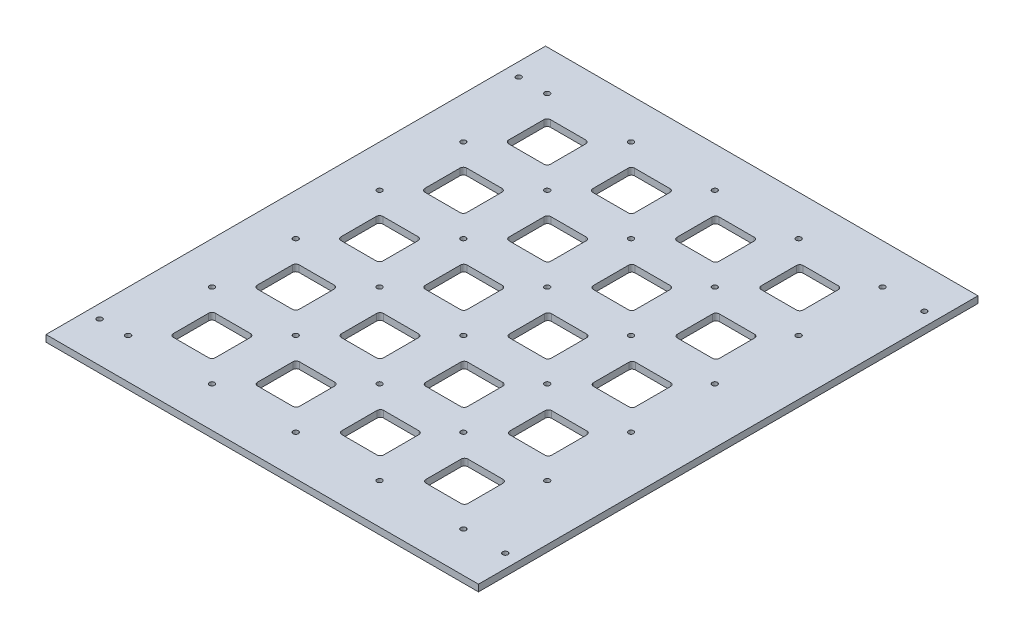
from build123d import *

# Parameters (mm, degrees)
SKETCH1_W           = 258
SKETCH1_H           = 298
SKETCH1_R           = 1.55
BOSS_EXTRUDE1_DEPTH = 4


with BuildPart() as part:
    # Sketch1 → Boss-Extrude1 (new body)
    with BuildSketch(Plane(origin=(0, 0, 0), x_dir=(1, 0, 0), z_dir=(0, 1, 0))):
        with Locations((-129, 149)):
            Rectangle(SKETCH1_W, SKETCH1_H)
        with Locations((-250, 274)):
            Circle(SKETCH1_R, mode=Mode.SUBTRACT)
        with Locations((-8, 274)):
            Circle(SKETCH1_R, mode=Mode.SUBTRACT)
        with Locations((-8, 24)):
            Circle(SKETCH1_R, mode=Mode.SUBTRACT)
        with Locations((-250, 24)):
            Circle(SKETCH1_R, mode=Mode.SUBTRACT)
        with Locations((-233, 274)):
            Circle(SKETCH1_R, mode=Mode.SUBTRACT)
        with Locations((-233, 224)):
            Circle(SKETCH1_R, mode=Mode.SUBTRACT)
        with Locations((-233, 174)):
            Circle(SKETCH1_R, mode=Mode.SUBTRACT)
        with Locations((-233, 124)):
            Circle(SKETCH1_R, mode=Mode.SUBTRACT)
        with Locations((-233, 74)):
            Circle(SKETCH1_R, mode=Mode.SUBTRACT)
        with Locations((-233, 24)):
            Circle(SKETCH1_R, mode=Mode.SUBTRACT)
        with Locations((-183, 24)):
            Circle(SKETCH1_R, mode=Mode.SUBTRACT)
        with Locations((-183, 74)):
            Circle(SKETCH1_R, mode=Mode.SUBTRACT)
        with Locations((-183, 124)):
            Circle(SKETCH1_R, mode=Mode.SUBTRACT)
        with Locations((-183, 174)):
            Circle(SKETCH1_R, mode=Mode.SUBTRACT)
        with Locations((-183, 224)):
            Circle(SKETCH1_R, mode=Mode.SUBTRACT)
        with Locations((-183, 274)):
            Circle(SKETCH1_R, mode=Mode.SUBTRACT)
        with Locations((-133, 24)):
            Circle(SKETCH1_R, mode=Mode.SUBTRACT)
        with Locations((-133, 74)):
            Circle(SKETCH1_R, mode=Mode.SUBTRACT)
        with Locations((-133, 124)):
            Circle(SKETCH1_R, mode=Mode.SUBTRACT)
        with Locations((-133, 174)):
            Circle(SKETCH1_R, mode=Mode.SUBTRACT)
        with Locations((-133, 224)):
            Circle(SKETCH1_R, mode=Mode.SUBTRACT)
        with Locations((-133, 274)):
            Circle(SKETCH1_R, mode=Mode.SUBTRACT)
        with Locations((-83, 24)):
            Circle(SKETCH1_R, mode=Mode.SUBTRACT)
        with Locations((-83, 74)):
            Circle(SKETCH1_R, mode=Mode.SUBTRACT)
        with Locations((-83, 124)):
            Circle(SKETCH1_R, mode=Mode.SUBTRACT)
        with Locations((-83, 174)):
            Circle(SKETCH1_R, mode=Mode.SUBTRACT)
        with Locations((-83, 224)):
            Circle(SKETCH1_R, mode=Mode.SUBTRACT)
        with Locations((-83, 274)):
            Circle(SKETCH1_R, mode=Mode.SUBTRACT)
        with Locations((-33, 24)):
            Circle(SKETCH1_R, mode=Mode.SUBTRACT)
        with Locations((-33, 74)):
            Circle(SKETCH1_R, mode=Mode.SUBTRACT)
        with Locations((-33, 124)):
            Circle(SKETCH1_R, mode=Mode.SUBTRACT)
        with Locations((-33, 174)):
            Circle(SKETCH1_R, mode=Mode.SUBTRACT)
        with Locations((-33, 224)):
            Circle(SKETCH1_R, mode=Mode.SUBTRACT)
        with Locations((-33, 274)):
            Circle(SKETCH1_R, mode=Mode.SUBTRACT)
        with BuildLine():
            Line((-218.5, 261.5), (-197.5, 261.5))
            ThreePointArc((-197.5, 261.5), (-196.085786438, 260.914213562), (-195.5, 259.5))
            Line((-195.5, 259.5), (-195.5, 238.5))
            ThreePointArc((-195.5, 238.5), (-196.085786438, 237.085786438), (-197.5, 236.5))
            Line((-197.5, 236.5), (-218.5, 236.5))
            ThreePointArc((-218.5, 236.5), (-219.914213562, 237.085786438), (-220.5, 238.5))
            Line((-220.5, 238.5), (-220.5, 259.5))
            ThreePointArc((-220.5, 259.5), (-219.914213562, 260.914213562), (-218.5, 261.5))
        make_face(mode=Mode.SUBTRACT)
        with BuildLine():
            Line((-170.273804043, 259.5), (-170.273804043, 238.5))
            ThreePointArc((-170.273804043, 238.5), (-169.688017605, 237.085786438), (-168.273804043, 236.5))
            Line((-168.273804043, 236.5), (-147.273804043, 236.5))
            ThreePointArc((-147.273804043, 236.5), (-145.85959048, 237.085786438), (-145.273804043, 238.5))
            Line((-145.273804043, 238.5), (-145.273804043, 259.5))
            ThreePointArc((-145.273804043, 259.5), (-145.85959048, 260.914213562), (-147.273804043, 261.5))
            Line((-147.273804043, 261.5), (-168.273804043, 261.5))
            ThreePointArc((-168.273804043, 261.5), (-169.688017605, 260.914213562), (-170.273804043, 259.5))
        make_face(mode=Mode.SUBTRACT)
        with BuildLine():
            Line((-120.047608086, 259.5), (-120.047608086, 238.5))
            ThreePointArc((-120.047608086, 238.5), (-119.461821648, 237.085786438), (-118.047608086, 236.5))
            Line((-118.047608086, 236.5), (-97.047608086, 236.5))
            ThreePointArc((-97.047608086, 236.5), (-95.633394523, 237.085786438), (-95.047608086, 238.5))
            Line((-95.047608086, 238.5), (-95.047608086, 259.5))
            ThreePointArc((-95.047608086, 259.5), (-95.633394523, 260.914213562), (-97.047608086, 261.5))
            Line((-97.047608086, 261.5), (-118.047608086, 261.5))
            ThreePointArc((-118.047608086, 261.5), (-119.461821648, 260.914213562), (-120.047608086, 259.5))
        make_face(mode=Mode.SUBTRACT)
        with BuildLine():
            Line((-69.821412128, 259.5), (-69.821412128, 238.5))
            ThreePointArc((-69.821412128, 238.5), (-69.235625691, 237.085786438), (-67.821412128, 236.5))
            Line((-67.821412128, 236.5), (-46.821412128, 236.5))
            ThreePointArc((-46.821412128, 236.5), (-45.407198566, 237.085786438), (-44.821412128, 238.5))
            Line((-44.821412128, 238.5), (-44.821412128, 259.5))
            ThreePointArc((-44.821412128, 259.5), (-45.407198566, 260.914213562), (-46.821412128, 261.5))
            Line((-46.821412128, 261.5), (-67.821412128, 261.5))
            ThreePointArc((-67.821412128, 261.5), (-69.235625691, 260.914213562), (-69.821412128, 259.5))
        make_face(mode=Mode.SUBTRACT)
        with BuildLine():
            Line((-220.5, 209.5), (-220.5, 188.5))
            ThreePointArc((-220.5, 188.5), (-219.914213562, 187.085786438), (-218.5, 186.5))
            Line((-218.5, 186.5), (-197.5, 186.5))
            ThreePointArc((-197.5, 186.5), (-196.085786438, 187.085786438), (-195.5, 188.5))
            Line((-195.5, 188.5), (-195.5, 209.5))
            ThreePointArc((-195.5, 209.5), (-196.085786438, 210.914213562), (-197.5, 211.5))
            Line((-197.5, 211.5), (-218.5, 211.5))
            ThreePointArc((-218.5, 211.5), (-219.914213562, 210.914213562), (-220.5, 209.5))
        make_face(mode=Mode.SUBTRACT)
        with BuildLine():
            Line((-170.273804043, 209.5), (-170.273804043, 188.5))
            ThreePointArc((-170.273804043, 188.5), (-169.688017605, 187.085786438), (-168.273804043, 186.5))
            Line((-168.273804043, 186.5), (-147.273804043, 186.5))
            ThreePointArc((-147.273804043, 186.5), (-145.85959048, 187.085786438), (-145.273804043, 188.5))
            Line((-145.273804043, 188.5), (-145.273804043, 209.5))
            ThreePointArc((-145.273804043, 209.5), (-145.85959048, 210.914213562), (-147.273804043, 211.5))
            Line((-147.273804043, 211.5), (-168.273804043, 211.5))
            ThreePointArc((-168.273804043, 211.5), (-169.688017605, 210.914213562), (-170.273804043, 209.5))
        make_face(mode=Mode.SUBTRACT)
        with BuildLine():
            Line((-120.047608086, 209.5), (-120.047608086, 188.5))
            ThreePointArc((-120.047608086, 188.5), (-119.461821648, 187.085786438), (-118.047608086, 186.5))
            Line((-118.047608086, 186.5), (-97.047608086, 186.5))
            ThreePointArc((-97.047608086, 186.5), (-95.633394523, 187.085786438), (-95.047608086, 188.5))
            Line((-95.047608086, 188.5), (-95.047608086, 209.5))
            ThreePointArc((-95.047608086, 209.5), (-95.633394523, 210.914213562), (-97.047608086, 211.5))
            Line((-97.047608086, 211.5), (-118.047608086, 211.5))
            ThreePointArc((-118.047608086, 211.5), (-119.461821648, 210.914213562), (-120.047608086, 209.5))
        make_face(mode=Mode.SUBTRACT)
        with BuildLine():
            Line((-69.821412128, 209.5), (-69.821412128, 188.5))
            ThreePointArc((-69.821412128, 188.5), (-69.235625691, 187.085786438), (-67.821412128, 186.5))
            Line((-67.821412128, 186.5), (-46.821412128, 186.5))
            ThreePointArc((-46.821412128, 186.5), (-45.407198566, 187.085786438), (-44.821412128, 188.5))
            Line((-44.821412128, 188.5), (-44.821412128, 209.5))
            ThreePointArc((-44.821412128, 209.5), (-45.407198566, 210.914213562), (-46.821412128, 211.5))
            Line((-46.821412128, 211.5), (-67.821412128, 211.5))
            ThreePointArc((-67.821412128, 211.5), (-69.235625691, 210.914213562), (-69.821412128, 209.5))
        make_face(mode=Mode.SUBTRACT)
        with BuildLine():
            Line((-220.5, 159.5), (-220.5, 138.5))
            ThreePointArc((-220.5, 138.5), (-219.914213562, 137.085786438), (-218.5, 136.5))
            Line((-218.5, 136.5), (-197.5, 136.5))
            ThreePointArc((-197.5, 136.5), (-196.085786438, 137.085786438), (-195.5, 138.5))
            Line((-195.5, 138.5), (-195.5, 159.5))
            ThreePointArc((-195.5, 159.5), (-196.085786438, 160.914213562), (-197.5, 161.5))
            Line((-197.5, 161.5), (-218.5, 161.5))
            ThreePointArc((-218.5, 161.5), (-219.914213562, 160.914213562), (-220.5, 159.5))
        make_face(mode=Mode.SUBTRACT)
        with BuildLine():
            Line((-170.273804043, 159.5), (-170.273804043, 138.5))
            ThreePointArc((-170.273804043, 138.5), (-169.688017605, 137.085786438), (-168.273804043, 136.5))
            Line((-168.273804043, 136.5), (-147.273804043, 136.5))
            ThreePointArc((-147.273804043, 136.5), (-145.85959048, 137.085786438), (-145.273804043, 138.5))
            Line((-145.273804043, 138.5), (-145.273804043, 159.5))
            ThreePointArc((-145.273804043, 159.5), (-145.85959048, 160.914213562), (-147.273804043, 161.5))
            Line((-147.273804043, 161.5), (-168.273804043, 161.5))
            ThreePointArc((-168.273804043, 161.5), (-169.688017605, 160.914213562), (-170.273804043, 159.5))
        make_face(mode=Mode.SUBTRACT)
        with BuildLine():
            Line((-120.047608086, 159.5), (-120.047608086, 138.5))
            ThreePointArc((-120.047608086, 138.5), (-119.461821648, 137.085786438), (-118.047608086, 136.5))
            Line((-118.047608086, 136.5), (-97.047608086, 136.5))
            ThreePointArc((-97.047608086, 136.5), (-95.633394523, 137.085786438), (-95.047608086, 138.5))
            Line((-95.047608086, 138.5), (-95.047608086, 159.5))
            ThreePointArc((-95.047608086, 159.5), (-95.633394523, 160.914213562), (-97.047608086, 161.5))
            Line((-97.047608086, 161.5), (-118.047608086, 161.5))
            ThreePointArc((-118.047608086, 161.5), (-119.461821648, 160.914213562), (-120.047608086, 159.5))
        make_face(mode=Mode.SUBTRACT)
        with BuildLine():
            Line((-69.821412128, 159.5), (-69.821412128, 138.5))
            ThreePointArc((-69.821412128, 138.5), (-69.235625691, 137.085786438), (-67.821412128, 136.5))
            Line((-67.821412128, 136.5), (-46.821412128, 136.5))
            ThreePointArc((-46.821412128, 136.5), (-45.407198566, 137.085786438), (-44.821412128, 138.5))
            Line((-44.821412128, 138.5), (-44.821412128, 159.5))
            ThreePointArc((-44.821412128, 159.5), (-45.407198566, 160.914213562), (-46.821412128, 161.5))
            Line((-46.821412128, 161.5), (-67.821412128, 161.5))
            ThreePointArc((-67.821412128, 161.5), (-69.235625691, 160.914213562), (-69.821412128, 159.5))
        make_face(mode=Mode.SUBTRACT)
        with BuildLine():
            Line((-220.5, 109.5), (-220.5, 88.5))
            ThreePointArc((-220.5, 88.5), (-219.914213562, 87.085786438), (-218.5, 86.5))
            Line((-218.5, 86.5), (-197.5, 86.5))
            ThreePointArc((-197.5, 86.5), (-196.085786438, 87.085786438), (-195.5, 88.5))
            Line((-195.5, 88.5), (-195.5, 109.5))
            ThreePointArc((-195.5, 109.5), (-196.085786438, 110.914213562), (-197.5, 111.5))
            Line((-197.5, 111.5), (-218.5, 111.5))
            ThreePointArc((-218.5, 111.5), (-219.914213562, 110.914213562), (-220.5, 109.5))
        make_face(mode=Mode.SUBTRACT)
        with BuildLine():
            Line((-170.273804043, 109.5), (-170.273804043, 88.5))
            ThreePointArc((-170.273804043, 88.5), (-169.688017605, 87.085786438), (-168.273804043, 86.5))
            Line((-168.273804043, 86.5), (-147.273804043, 86.5))
            ThreePointArc((-147.273804043, 86.5), (-145.85959048, 87.085786438), (-145.273804043, 88.5))
            Line((-145.273804043, 88.5), (-145.273804043, 109.5))
            ThreePointArc((-145.273804043, 109.5), (-145.85959048, 110.914213562), (-147.273804043, 111.5))
            Line((-147.273804043, 111.5), (-168.273804043, 111.5))
            ThreePointArc((-168.273804043, 111.5), (-169.688017605, 110.914213562), (-170.273804043, 109.5))
        make_face(mode=Mode.SUBTRACT)
        with BuildLine():
            Line((-120.047608086, 109.5), (-120.047608086, 88.5))
            ThreePointArc((-120.047608086, 88.5), (-119.461821648, 87.085786438), (-118.047608086, 86.5))
            Line((-118.047608086, 86.5), (-97.047608086, 86.5))
            ThreePointArc((-97.047608086, 86.5), (-95.633394523, 87.085786438), (-95.047608086, 88.5))
            Line((-95.047608086, 88.5), (-95.047608086, 109.5))
            ThreePointArc((-95.047608086, 109.5), (-95.633394523, 110.914213562), (-97.047608086, 111.5))
            Line((-97.047608086, 111.5), (-118.047608086, 111.5))
            ThreePointArc((-118.047608086, 111.5), (-119.461821648, 110.914213562), (-120.047608086, 109.5))
        make_face(mode=Mode.SUBTRACT)
        with BuildLine():
            Line((-69.821412128, 109.5), (-69.821412128, 88.5))
            ThreePointArc((-69.821412128, 88.5), (-69.235625691, 87.085786438), (-67.821412128, 86.5))
            Line((-67.821412128, 86.5), (-46.821412128, 86.5))
            ThreePointArc((-46.821412128, 86.5), (-45.407198566, 87.085786438), (-44.821412128, 88.5))
            Line((-44.821412128, 88.5), (-44.821412128, 109.5))
            ThreePointArc((-44.821412128, 109.5), (-45.407198566, 110.914213562), (-46.821412128, 111.5))
            Line((-46.821412128, 111.5), (-67.821412128, 111.5))
            ThreePointArc((-67.821412128, 111.5), (-69.235625691, 110.914213562), (-69.821412128, 109.5))
        make_face(mode=Mode.SUBTRACT)
        with BuildLine():
            Line((-220.5, 59.5), (-220.5, 38.5))
            ThreePointArc((-220.5, 38.5), (-219.914213562, 37.085786438), (-218.5, 36.5))
            Line((-218.5, 36.5), (-197.5, 36.5))
            ThreePointArc((-197.5, 36.5), (-196.085786438, 37.085786438), (-195.5, 38.5))
            Line((-195.5, 38.5), (-195.5, 59.5))
            ThreePointArc((-195.5, 59.5), (-196.085786438, 60.914213562), (-197.5, 61.5))
            Line((-197.5, 61.5), (-218.5, 61.5))
            ThreePointArc((-218.5, 61.5), (-219.914213562, 60.914213562), (-220.5, 59.5))
        make_face(mode=Mode.SUBTRACT)
        with BuildLine():
            Line((-170.273804043, 59.5), (-170.273804043, 38.5))
            ThreePointArc((-170.273804043, 38.5), (-169.688017605, 37.085786438), (-168.273804043, 36.5))
            Line((-168.273804043, 36.5), (-147.273804043, 36.5))
            ThreePointArc((-147.273804043, 36.5), (-145.85959048, 37.085786438), (-145.273804043, 38.5))
            Line((-145.273804043, 38.5), (-145.273804043, 59.5))
            ThreePointArc((-145.273804043, 59.5), (-145.85959048, 60.914213562), (-147.273804043, 61.5))
            Line((-147.273804043, 61.5), (-168.273804043, 61.5))
            ThreePointArc((-168.273804043, 61.5), (-169.688017605, 60.914213562), (-170.273804043, 59.5))
        make_face(mode=Mode.SUBTRACT)
        with BuildLine():
            Line((-120.047608086, 59.5), (-120.047608086, 38.5))
            ThreePointArc((-120.047608086, 38.5), (-119.461821648, 37.085786438), (-118.047608086, 36.5))
            Line((-118.047608086, 36.5), (-97.047608086, 36.5))
            ThreePointArc((-97.047608086, 36.5), (-95.633394523, 37.085786438), (-95.047608086, 38.5))
            Line((-95.047608086, 38.5), (-95.047608086, 59.5))
            ThreePointArc((-95.047608086, 59.5), (-95.633394523, 60.914213562), (-97.047608086, 61.5))
            Line((-97.047608086, 61.5), (-118.047608086, 61.5))
            ThreePointArc((-118.047608086, 61.5), (-119.461821648, 60.914213562), (-120.047608086, 59.5))
        make_face(mode=Mode.SUBTRACT)
        with BuildLine():
            Line((-69.821412128, 59.5), (-69.821412128, 38.5))
            ThreePointArc((-69.821412128, 38.5), (-69.235625691, 37.085786438), (-67.821412128, 36.5))
            Line((-67.821412128, 36.5), (-46.821412128, 36.5))
            ThreePointArc((-46.821412128, 36.5), (-45.407198566, 37.085786438), (-44.821412128, 38.5))
            Line((-44.821412128, 38.5), (-44.821412128, 59.5))
            ThreePointArc((-44.821412128, 59.5), (-45.407198566, 60.914213562), (-46.821412128, 61.5))
            Line((-46.821412128, 61.5), (-67.821412128, 61.5))
            ThreePointArc((-67.821412128, 61.5), (-69.235625691, 60.914213562), (-69.821412128, 59.5))
        make_face(mode=Mode.SUBTRACT)
    extrude(amount=BOSS_EXTRUDE1_DEPTH)


solid = part.part
